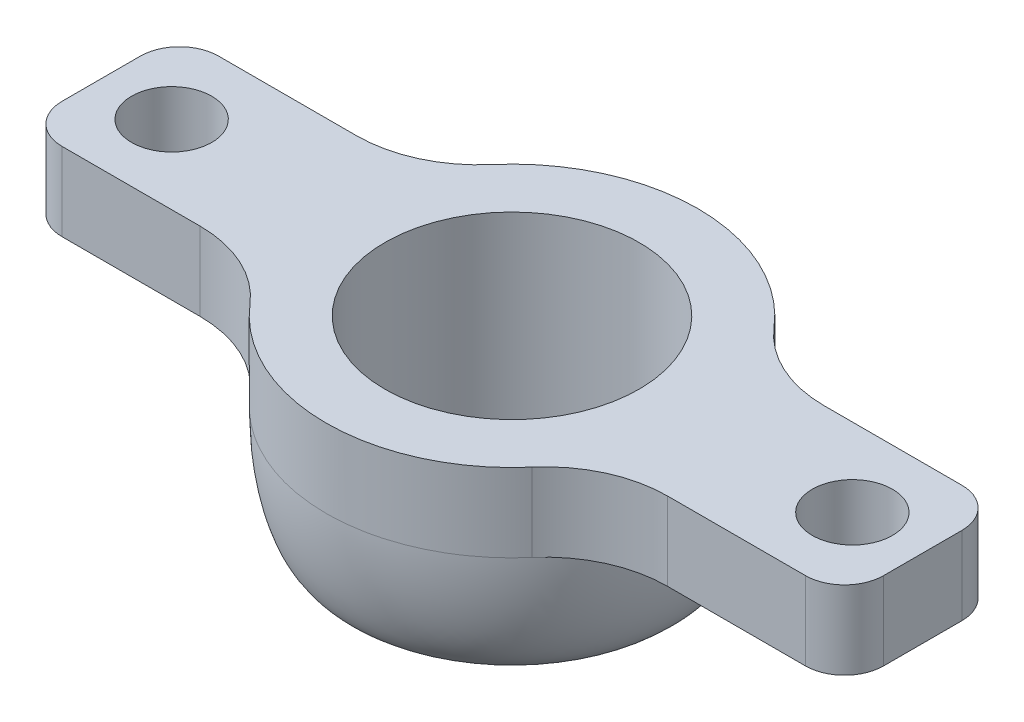
from build123d import *

# Parameters (mm, degrees)
SKETCH1_R           = 4.75
SKETCH1_R_2         = 3.25
BOSS_EXTRUDE1_DEPTH = 5
BOSS_EXTRUDE2_START = -2
BOSS_EXTRUDE2_DEPTH = 2
SKETCH3_R           = 1.025
CUT_EXTRUDE1_DEPTH  = 12.908505364
FILLET1_R           = 3.125
FILLET2_R           = 1
FILLET3_SIZE        = 3
FILLET3_SIZE_2      = 1


with BuildPart() as part:
    # Sketch1 → Boss-Extrude1 (new body)
    with BuildSketch(Plane(origin=(0, 0, 0), x_dir=(1, 0, 0), z_dir=(0, 1, 0))):
        with Locations(Location((0, 0, 0), (0, 0, 270))):
            Circle(SKETCH1_R)
        with Locations(Location((0, 0, 0), (0, 0, 270))):
            Circle(SKETCH1_R_2, mode=Mode.SUBTRACT)
    extrude(amount=BOSS_EXTRUDE1_DEPTH)

    # Sketch2 → Boss-Extrude2 (add)
    with BuildSketch(Plane(origin=(0, 5, 0), x_dir=(1, 0, 0), z_dir=(0, 1, 0)).offset(BOSS_EXTRUDE2_START)):
        with BuildLine():
            ThreePointArc((4.75, 0), (4.63829195, -1.024083876), (4.308421985, -2))
            Line((4.308421985, -2), (10.5, -2))
            Line((10.5, -2), (10.5, 2))
            Line((10.5, 2), (4.308421985, 2))
            ThreePointArc((4.308421985, 2), (4.63829195, 1.024083876), (4.75, 0))
        make_face()
        with BuildLine():
            Line((-10.5, -2), (-4.308421985, -2))
            ThreePointArc((-4.308421985, -2), (-4.75, 0), (-4.308421985, 2))
            Line((-4.308421985, 2), (-10.5, 2))
            Line((-10.5, 2), (-10.5, -2))
        make_face()
    extrude(amount=BOSS_EXTRUDE2_DEPTH)

    # Sketch3 → Cut-Extrude1 (cut, through all)
    with BuildSketch(Plane.XZ.offset(-3)):
        with Locations(Location((8.7, 0, 0), (0, 0, 270))):
            Circle(SKETCH3_R)
        with Locations(Location((-8.7, 0, 0), (0, 0, 270))):
            Circle(SKETCH3_R)
    extrude(amount=-CUT_EXTRUDE1_DEPTH, mode=Mode.SUBTRACT)

    # Fillet1
    fillet1_edges = [part.edges().sort_by_distance(p)[0] for p in [
        (4.308421985, 4, 2),
        (4.308421985, 4, -2),
        (-4.308421985, 4, -2),
        (-4.308421985, 4, 2),
    ]]
    fillet(fillet1_edges, radius=FILLET1_R)

    # Fillet2
    fillet2_edges = [part.edges().sort_by_distance(p)[0] for p in [
        (10.5, 4, 2),
        (10.5, 4, -2),
        (-10.5, 4, -2),
        (-10.5, 4, 2),
    ]]
    fillet(fillet2_edges, radius=FILLET2_R)

    # Fillet3
    # an asymmetric fillet: 3, 1 mm, written as the material it takes off along each edge
    with BuildSketch(Plane(origin=(0, 0, 0), x_dir=(0, 0, 1), z_dir=(-1, 0, 0))) as fillet3_piece_1:
        with BuildLine():
            Bezier((4.75, FILLET3_SIZE), (4.75, 0), (4.75 - FILLET3_SIZE_2, 0), weights=[1, 0.707106781, 1])
            Line((4.75 - FILLET3_SIZE_2, 0), (4.75, 0))
            Line((4.75, 0), (4.75, FILLET3_SIZE))
        make_face()
    revolve(axis=Axis((0, 0, 0), (0, 1, 0)), mode=Mode.SUBTRACT)


solid = part.part
